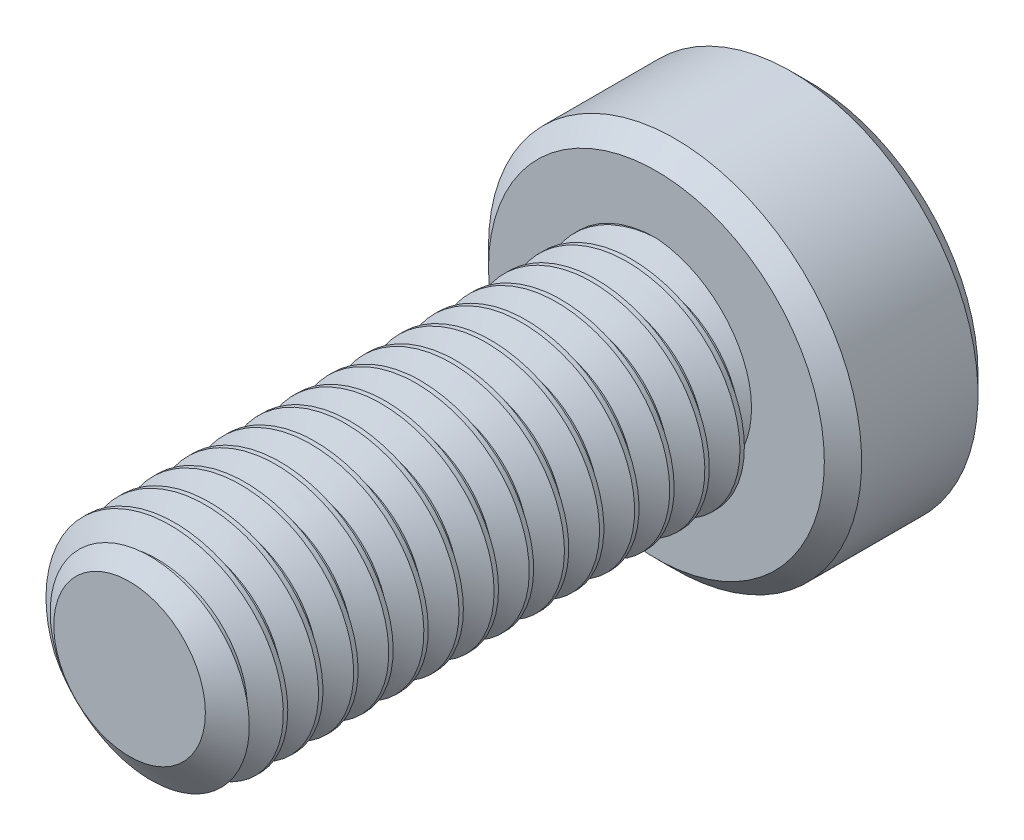
from build123d import *

# Parameters (mm, degrees)
SKETCH1_R          = 2.5
EXTRUDE1_DEPTH     = 12
CUT_SWEEP1_PITCH   = 0.8
SKETCH6_R          = 4.25
EXTRUDE2_DEPTH     = 3.5
CUT_EXTRUDE1_DEPTH = 2.25
CHAMFER1_SIZE      = 0.425


with BuildPart() as part:
    # Sketch1 → Extrude1 (new body)
    with BuildSketch(Plane.XY):
        Circle(SKETCH1_R)
    extrude(amount=-EXTRUDE1_DEPTH)

    # Cut-Sweep1: the profile of Sketch3 profile screwed along a right-hand helix of 16 turns, 6 arcs to a turn; built about Z, then put on its axis
    cut_sweep1_z = Axis((0, 0, 0), (0, 0, 1))
    cut_sweep1_corners = [(2.5003, 0, -0.700173205), (1.980384758, 0, -0.4), (1.980384758, 0, -0.3), (2.5003, 0, 0.000173205)]
    with BuildLine(mode=Mode.PRIVATE) as cut_sweep1_profile:
        Line(cut_sweep1_corners[0], cut_sweep1_corners[1])
        Line(cut_sweep1_corners[1], cut_sweep1_corners[2])
        Line(cut_sweep1_corners[2], cut_sweep1_corners[3])
        Line(cut_sweep1_corners[3], cut_sweep1_corners[0])
    cut_sweep1_cap = Face(cut_sweep1_profile.wire())
    cut_sweep1_turn_angles = [0, 30, 60, 90, 120, 150, 180, 210, 240, 270, 300, 330, 360]
    cut_sweep1_turn_weights = [1, 0.8660254037844387, 1, 0.8660254037844387, 1, 0.8660254037844387, 1, 0.8660254037844387, 1, 0.8660254037844387, 1, 0.8660254037844387, 1]
    cut_sweep1_turn_rails = [Edge.make_bspline([Vector(p[0], p[1], 0).rotate(cut_sweep1_z, cut_sweep1_turn_angles[k]) / cut_sweep1_turn_weights[k] + Vector(0, 0, p[2] + CUT_SWEEP1_PITCH * cut_sweep1_turn_angles[k] / 360) for k in range(13)], [0, 0, 0, 1, 1, 2, 2, 3, 3, 4, 4, 5, 5, 6, 6, 6], 2, cut_sweep1_turn_weights) for p in cut_sweep1_corners]
    cut_sweep1_turn_sides = [Face.make_surface_from_curves(cut_sweep1_turn_rails[p[0]], cut_sweep1_turn_rails[p[1]]) for p in [(0, 1), (1, 2), (2, 3), (3, 0)]]
    cut_sweep1 = Plane(origin=(0, 0, 0), x_dir=(0, 1, 0), z_dir=(0, 0, -1)) * Solid(Shell([*[p.moved(Location((0, 0, CUT_SWEEP1_PITCH * i))) for i in range(16) for p in cut_sweep1_turn_sides], cut_sweep1_cap, cut_sweep1_cap.rotate(cut_sweep1_z, 5760).moved(Location((0, 0, CUT_SWEEP1_PITCH * 5760 / 360)))]))
    add(cut_sweep1, mode=Mode.SUBTRACT)

    # Sketch4 → Cut-Revolve1 (revolve, cut)
    with BuildSketch(Plane(origin=(0, 0, 0), x_dir=(0, 0, -1), z_dir=(1, 0, 0)), mode=Mode.PRIVATE) as cut_revolve1_sk:
        Polygon((0.541691224, 2.5), (0, 1.726384758), (0, 2.5), align=None)
    revolve(cut_revolve1_sk.sketch.rotate(Axis((0, 0, 0), (0, 0, -1)), 260.43858876), axis=Axis((0, 0, 0), (0, 0, -1)), mode=Mode.SUBTRACT)

    # Sketch6 → Extrude2 (add)
    with BuildSketch(Plane(origin=(0, 0, -12), x_dir=(-1, 0, 0), z_dir=(0, 0, -1))):
        Circle(SKETCH6_R)
    extrude(amount=EXTRUDE2_DEPTH)

    # Sketch7 → Cut-Extrude1 (cut)
    with BuildSketch(Plane(origin=(0, 0, -15.5), x_dir=(-1, 0, 0), z_dir=(0, 0, -1))):
        Polygon((0, 1.732050808), (-1.5, 0.866025404), (-1.5, -0.866025404), (0, -1.732050808), (1.5, -0.866025404), (1.5, 0.866025404), align=None)
    extrude(amount=-CUT_EXTRUDE1_DEPTH, mode=Mode.SUBTRACT)

    # Cut-Extrude2 cone 1 section (through the dimple's axis) → Cut-Extrude2 (revolve, cut)
    with BuildSketch(Plane(origin=(0, 0, -15.5), x_dir=(0, 1, 0), z_dir=(1, 0, 0))):
        Polygon((0, 0), (1.732050808, 0), (0, 1.732050808), align=None)
    revolve(axis=Axis((0, 0, -15.5), (0, 0, 1)), mode=Mode.SUBTRACT)

    # Chamfer1
    chamfer1_edges = [part.edges().sort_by_distance(p)[0] for p in [
        (4.25, 0, -12),
        (4.25, 0, -15.5),
    ]]
    chamfer(chamfer1_edges, length=CHAMFER1_SIZE)


solid = part.part
